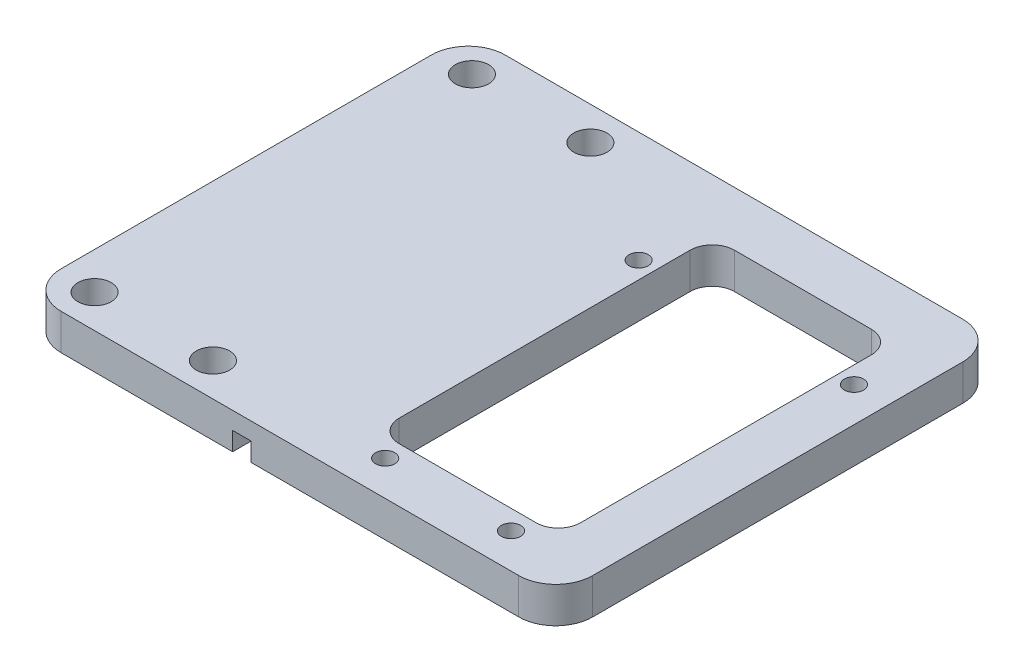
from build123d import *

# Parameters (mm, degrees)
T_LE_DE_BASE_PLI_E1_DEPTH     = 60
ENL_V_MAT_EXTRU_1_REACH       = 84.492
ESQUISSE7_W                   = 24.5
ESQUISSE7_H                   = 45.3
ENL_V_MAT_EXTRU_2_REACH       = 84.492
ESQUISSE8_R                   = 1.3
ENL_V_MAT_EXTRU_3_REACH       = 81.889
ESQUISSE9_R                   = 2.25
CONG_1_R                      = 3
CONG_2_R                      = 5
ENL_V_MAT_EXTRU_4_OUTLINE_W   = 9
ENL_V_MAT_EXTRU_4_OUTLINE_H   = 60
ENL_V_MAT_EXTRU_4_DEPTH       = 28.15
ENL_V_START                   = -2.5
ENL_V_MAT_EXTRU_4_2_OUTLINE_W = 2.5
ENL_V_MAT_EXTRU_4_2_OUTLINE_H = 60
ENL_V_MAT_EXTRU_4_2_DEPTH     = 2.5
ENL_V_START_2                 = -4.85
ENL_V_MAT_EXTRU_4_3_OUTLINE_R = 2.25
ENL_V_MAT_EXTRU_4_3_OUTLINE_W = 4.160785036
ENL_V_MAT_EXTRU_4_3_OUTLINE_H = 60
ENL_V_MAT_EXTRU_4_3_DEPTH     = 4.85
ENL_V_MAT_EXTRU_4_4_OUTLINE_W = 2.5
ENL_V_MAT_EXTRU_4_4_OUTLINE_H = 60
ENL_V_MAT_EXTRU_4_4_DEPTH     = 2.35


# Read off the part's stored shape, not the designer's step: Tôle de base pliée1, Enlèv. mat.-Extru.4
with BuildPart() as part:
    # Tôle de base pliée1 outline → Tôle de base pliée1 (new body)
    with BuildSketch(Plane.XY):
        with BuildLine():
            Line((7.85, 28.15), (46, 28.15))
            Line((46, 28.15), (46, 33))
            Line((46, 33), (7.85, 33))
            ThreePointArc((7.85, 33), (2.299211768, 30.700788232), (0, 25.15))
            Line((0, 25.15), (0, 0))
            Line((0, 0), (4.85, 0))
            Line((4.85, 0), (4.85, 25.15))
            ThreePointArc((4.85, 25.15), (5.728679656, 27.271320344), (7.85, 28.15))
        make_face()
    extrude(amount=T_LE_DE_BASE_PLI_E1_DEPTH)

    # Esquisse7 → Enlèv. mat.-Extru.1 (cut, up to next)
    with BuildSketch(Plane(origin=(0, 33, 0), x_dir=(1, 0, 0), z_dir=(0, 1, 0)), mode=Mode.PRIVATE) as enl_v_mat_extru_1_sk1:
        with Locations((26.75, -30)):
            Rectangle(ESQUISSE7_W, ESQUISSE7_H)
    enl_v_mat_extru_1_tool1 = extrude(enl_v_mat_extru_1_sk1.sketch, amount=-ENL_V_MAT_EXTRU_1_REACH, mode=Mode.PRIVATE) & part.part
    add(enl_v_mat_extru_1_tool1.solids().sort_by_distance((26.75, 33, 30))[0], mode=Mode.SUBTRACT)

    # Esquisse8 → Enlèv. mat.-Extru.2 (cut, up to next)
    with BuildSketch(Plane(origin=(0, 33, 0), x_dir=(1, 0, 0), z_dir=(0, 1, 0)), mode=Mode.PRIVATE) as enl_v_mat_extru_2_sk1:
        with Locations(Location((18.25, -55.3, 0), (0, 0, 270))):
            Circle(ESQUISSE8_R)
    enl_v_mat_extru_2_tool1 = extrude(enl_v_mat_extru_2_sk1.sketch, amount=-ENL_V_MAT_EXTRU_2_REACH, mode=Mode.PRIVATE) & part.part
    # Esquisse8 → Enlèv. mat.-Extru.2 (cut, up to next)
    with BuildSketch(Plane(origin=(0, 33, 0), x_dir=(1, 0, 0), z_dir=(0, 1, 0)), mode=Mode.PRIVATE) as enl_v_mat_extru_2_sk2:
        with Locations(Location((35.25, -55.3, 0), (0, 0, 270))):
            Circle(ESQUISSE8_R)
    enl_v_mat_extru_2_tool2 = extrude(enl_v_mat_extru_2_sk2.sketch, amount=-ENL_V_MAT_EXTRU_2_REACH, mode=Mode.PRIVATE) & part.part
    # Esquisse8 → Enlèv. mat.-Extru.2 (cut, up to next)
    with BuildSketch(Plane(origin=(0, 33, 0), x_dir=(1, 0, 0), z_dir=(0, 1, 0)), mode=Mode.PRIVATE) as enl_v_mat_extru_2_sk3:
        with Locations(Location((41.3, -15, 0), (0, 0, 270))):
            Circle(ESQUISSE8_R)
    enl_v_mat_extru_2_tool3 = extrude(enl_v_mat_extru_2_sk3.sketch, amount=-ENL_V_MAT_EXTRU_2_REACH, mode=Mode.PRIVATE) & part.part
    # Esquisse8 → Enlèv. mat.-Extru.2 (cut, up to next)
    with BuildSketch(Plane(origin=(0, 33, 0), x_dir=(1, 0, 0), z_dir=(0, 1, 0)), mode=Mode.PRIVATE) as enl_v_mat_extru_2_sk4:
        with Locations(Location((12.2, -15, 0), (0, 0, 270))):
            Circle(ESQUISSE8_R)
    enl_v_mat_extru_2_tool4 = extrude(enl_v_mat_extru_2_sk4.sketch, amount=-ENL_V_MAT_EXTRU_2_REACH, mode=Mode.PRIVATE) & part.part
    add(enl_v_mat_extru_2_tool1.solids().sort_by_distance((18.25, 33, 55.3))[0], mode=Mode.SUBTRACT)
    add(enl_v_mat_extru_2_tool2.solids().sort_by_distance((35.25, 33, 55.3))[0], mode=Mode.SUBTRACT)
    add(enl_v_mat_extru_2_tool3.solids().sort_by_distance((41.3, 33, 15))[0], mode=Mode.SUBTRACT)
    add(enl_v_mat_extru_2_tool4.solids().sort_by_distance((12.2, 33, 15))[0], mode=Mode.SUBTRACT)

    # Esquisse9 → Enlèv. mat.-Extru.3 (cut, up to next)
    with BuildSketch(Plane(origin=(4.85, 0, 0), x_dir=(0, 0, -1), z_dir=(1, 0, 0)), mode=Mode.PRIVATE) as enl_v_mat_extru_3_sk1:
        with Locations((-4.5, 5)):
            Circle(ESQUISSE9_R)
    enl_v_mat_extru_3_tool1 = extrude(enl_v_mat_extru_3_sk1.sketch, amount=-ENL_V_MAT_EXTRU_3_REACH, mode=Mode.PRIVATE) & part.part
    # Esquisse9 → Enlèv. mat.-Extru.3 (cut, up to next)
    with BuildSketch(Plane(origin=(4.85, 0, 0), x_dir=(0, 0, -1), z_dir=(1, 0, 0)), mode=Mode.PRIVATE) as enl_v_mat_extru_3_sk2:
        with Locations(Location((-4.5, 21, 0), (0, 0, 180))):
            Circle(ESQUISSE9_R)
    enl_v_mat_extru_3_tool2 = extrude(enl_v_mat_extru_3_sk2.sketch, amount=-ENL_V_MAT_EXTRU_3_REACH, mode=Mode.PRIVATE) & part.part
    # Esquisse9 → Enlèv. mat.-Extru.3 (cut, up to next)
    with BuildSketch(Plane(origin=(4.85, 0, 0), x_dir=(0, 0, -1), z_dir=(1, 0, 0)), mode=Mode.PRIVATE) as enl_v_mat_extru_3_sk3:
        with Locations((-55.5, 21)):
            Circle(ESQUISSE9_R)
    enl_v_mat_extru_3_tool3 = extrude(enl_v_mat_extru_3_sk3.sketch, amount=-ENL_V_MAT_EXTRU_3_REACH, mode=Mode.PRIVATE) & part.part
    # Esquisse9 → Enlèv. mat.-Extru.3 (cut, up to next)
    with BuildSketch(Plane(origin=(4.85, 0, 0), x_dir=(0, 0, -1), z_dir=(1, 0, 0)), mode=Mode.PRIVATE) as enl_v_mat_extru_3_sk4:
        with Locations(Location((-55.5, 5, 0), (0, 0, 180))):
            Circle(ESQUISSE9_R)
    enl_v_mat_extru_3_tool4 = extrude(enl_v_mat_extru_3_sk4.sketch, amount=-ENL_V_MAT_EXTRU_3_REACH, mode=Mode.PRIVATE) & part.part
    add(enl_v_mat_extru_3_tool1.solids().sort_by_distance((4.85, 5, 4.5))[0], mode=Mode.SUBTRACT)
    add(enl_v_mat_extru_3_tool2.solids().sort_by_distance((4.85, 21, 4.5))[0], mode=Mode.SUBTRACT)
    add(enl_v_mat_extru_3_tool3.solids().sort_by_distance((4.85, 21, 55.5))[0], mode=Mode.SUBTRACT)
    add(enl_v_mat_extru_3_tool4.solids().sort_by_distance((4.85, 5, 55.5))[0], mode=Mode.SUBTRACT)

    # Congé1
    cong_1_edges = [part.edges().sort_by_distance(p)[0] for p in [
        (14.5, 30.575, 52.65),
        (14.5, 30.575, 7.35),
        (39, 30.575, 7.35),
        (39, 30.575, 52.65),
    ]]
    fillet(cong_1_edges, radius=CONG_1_R)

    # Congé2
    cong_2_edges = [part.edges().sort_by_distance(p)[0] for p in [
        (2.425, 0, 60),
        (46, 30.575, 60),
        (2.425, 0, 0),
        (46, 30.575, 0),
    ]]
    fillet(cong_2_edges, radius=CONG_2_R)

    # Enlèv. mat.-Extru.4 outline → Enlèv. mat.-Extru.4 (cut)
    with BuildSketch(Plane.XZ.offset(-28.15)):
        with Locations((4.5, 30)):
            Rectangle(ENL_V_MAT_EXTRU_4_OUTLINE_W, ENL_V_MAT_EXTRU_4_OUTLINE_H)
    extrude(amount=ENL_V_MAT_EXTRU_4_DEPTH, mode=Mode.SUBTRACT)

    # Enl_v. mat.-Extru.4 2 outline → Enl_v. mat.-Extru.4 2 (cut)
    with BuildSketch(Plane.XZ.offset(-28.15).offset(ENL_V_START)):
        with Locations((3.589214964, 30)):
            Rectangle(ENL_V_MAT_EXTRU_4_2_OUTLINE_W, ENL_V_MAT_EXTRU_4_2_OUTLINE_H)
    extrude(amount=ENL_V_MAT_EXTRU_4_2_DEPTH, mode=Mode.SUBTRACT)

    # Enl_v. mat.-Extru.4 3 outline → Enl_v. mat.-Extru.4 3 (add)
    # profile 1 of 2: a face of its own
    with BuildSketch(Plane.XZ.offset(-28.15).offset(ENL_V_START_2)):
        with BuildLine():
            ThreePointArc((-25.821570073, 5), (-24.357103979, 1.464466094), (-20.821570073, 0))
            Line((-20.821570073, 0), (2.339214964, 0))
            Line((2.339214964, 0), (2.339214964, 60))
            Line((2.339214964, 60), (-20.821570073, 60))
            ThreePointArc((-20.821570073, 60), (-24.357103979, 58.535533906), (-25.821570073, 55))
            Line((-25.821570073, 55), (-25.821570073, 5))
        make_face()
        with Locations((-20.821570073, 4.5)):
            Circle(ENL_V_MAT_EXTRU_4_3_OUTLINE_R, mode=Mode.SUBTRACT)
        with Locations((-4.821570073, 4.5)):
            Circle(ENL_V_MAT_EXTRU_4_3_OUTLINE_R, mode=Mode.SUBTRACT)
        with Locations((-20.821570073, 55.5)):
            Circle(ENL_V_MAT_EXTRU_4_3_OUTLINE_R, mode=Mode.SUBTRACT)
        with Locations((-4.821570073, 55.5)):
            Circle(ENL_V_MAT_EXTRU_4_3_OUTLINE_R, mode=Mode.SUBTRACT)
    # profile 2 of 2: a face of its own
    with BuildSketch(Plane.XZ.offset(-28.15).offset(ENL_V_START_2)):
        with Locations((6.919607482, 30)):
            Rectangle(ENL_V_MAT_EXTRU_4_3_OUTLINE_W, ENL_V_MAT_EXTRU_4_3_OUTLINE_H)
    extrude(amount=ENL_V_MAT_EXTRU_4_3_DEPTH)

    # Enl_v. mat.-Extru.4 4 outline → Enl_v. mat.-Extru.4 4 (add)
    with BuildSketch(Plane.XZ.offset(-28.15).offset(ENL_V_START_2)):
        with Locations((3.589214964, 30)):
            Rectangle(ENL_V_MAT_EXTRU_4_4_OUTLINE_W, ENL_V_MAT_EXTRU_4_4_OUTLINE_H)
    extrude(amount=ENL_V_MAT_EXTRU_4_4_DEPTH)


solid = part.part
